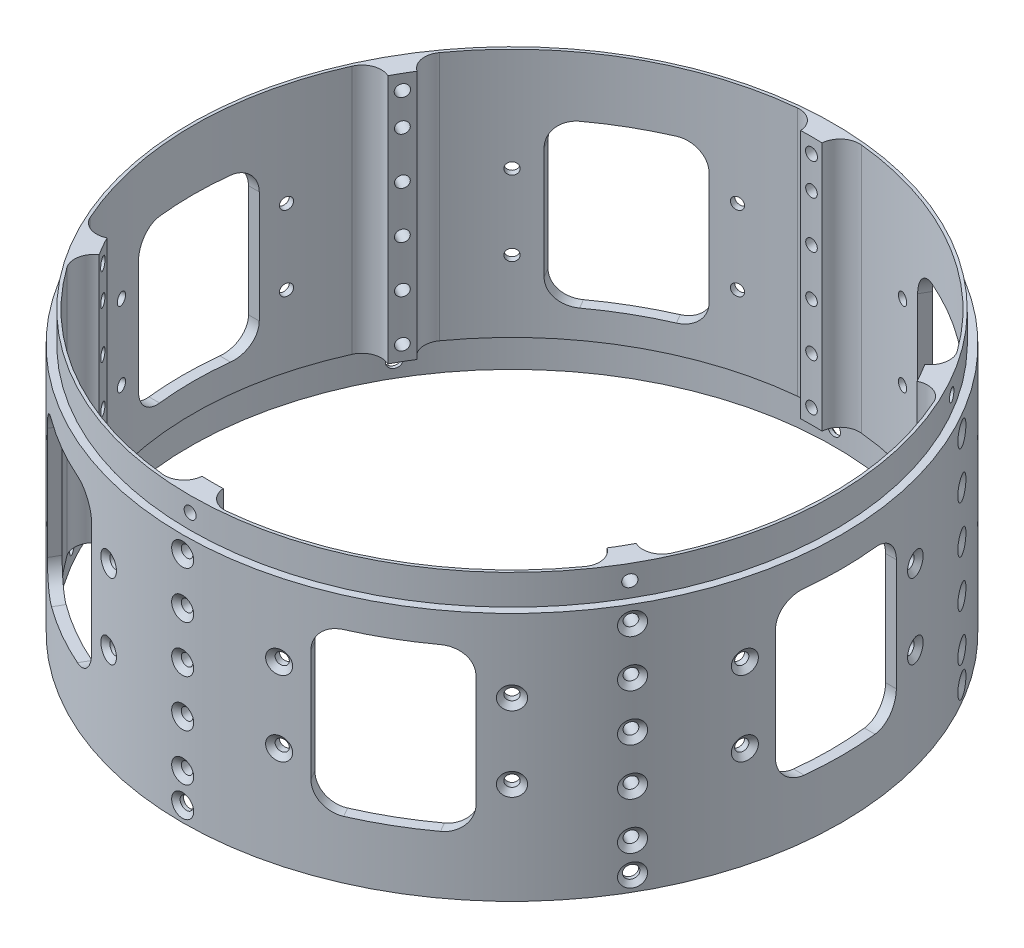
from build123d import *

# Parameters (mm, degrees)
CUT_EXTRUDE1_DEPTH                          = 139.23761861374788
CIRPATTERN1_COUNT                           = 6
CSK_FOR_4_FLAT_HEAD_MACHINE_SCREW_2_A_COUNT = 2
CSK_FOR_4_FLAT_HEAD_MACHINE_SCREW_2_A_PITCH = 11.938000000000002
CSK_FOR_4_FLAT_HEAD_MACHINE_SCREW_3_COUNT   = 2
CSK_FOR_4_FLAT_HEAD_MACHINE_SCREW_3_PITCH   = 23.875999999999998
CSK_FOR_4_FLAT_HEAD_MACHINE_SCREW_4_COUNT   = 2
CSK_FOR_4_FLAT_HEAD_MACHINE_SCREW_4_PITCH   = 23.876000000000005
CSK_FOR_4_FLAT_HEAD_MACHINE_SCREW_5_COUNT   = 2
CSK_FOR_4_FLAT_HEAD_MACHINE_SCREW_5_PITCH   = 11.938000000000006
CIRPATTERN2_COUNT                           = 6
CUT_EXTRUDE2_DEPTH                          = 139.23761878646496
CSK_FOR_4_FLAT_HEAD_MACHINE_SCREW_6_A_COUNT = 2
CSK_FOR_4_FLAT_HEAD_MACHINE_SCREW_6_A_PITCH = 19.05
CIRPATTERN5_COUNT                           = 6


with BuildPart() as part:
    # Sketch1 → Revolve1 (revolve)
    with BuildSketch(Plane.XY, mode=Mode.PRIVATE) as revolve1_sk:
        Polygon((76.20000000000003, -63.5), (76.20000000000003, 0), (81.88960000000003, 0), (81.88960000000003, -7.6708), (83.82000000000004, -7.670799999999989), (83.82000000000004, -71.12), (81.94040000000005, -71.12), (81.94040000000004, -63.5), align=None)
    revolve(revolve1_sk.sketch.rotate(Axis((0, 42.39510168777739, 0), (0, -1, 0)), 90), axis=Axis((0, 42.39510168777739, 0), (0, -1, 0)))

    # Sketch2 → Cut-Extrude1 (cut, through all)
    with BuildSketch(Plane(origin=(0, 0, 0), x_dir=(1, 0, 0), z_dir=(0, 1, 0))):
        with BuildLine():
            ThreePointArc((-8.128016987239903, 80.71940796125271), (-40.563800000000136, 70.25856254806241), (-65.8410493792649, 47.39877317396734))
            ThreePointArc((-65.8410493792649, 47.39877317396734), (-64.72088607812911, 40.52071256804154), (-57.842825472203295, 41.64087586917733))
            ThreePointArc((-57.842825472203295, 41.64087586917733), (-35.63620000000011, 61.72370898868599), (-7.140643602440563, 70.9137942201863))
            ThreePointArc((-7.140643602440563, 70.9137942201863), (-2.7315234243070465, 76.3102877831192), (-8.128016987239903, 80.71940796125271))
        make_face()
    cut_extrude1 = extrude(amount=-CUT_EXTRUDE1_DEPTH, mode=Mode.SUBTRACT)

    # CirPattern1: Cut-Extrude1 ×6 about axis
    cirpattern1_axis = Axis((-4.682e-14, 0, 2.819e-14), (0, 1, 0))
    for i in range(1, CIRPATTERN1_COUNT):
        add(cut_extrude1.rotate(cirpattern1_axis, i * 360 / CIRPATTERN1_COUNT), mode=Mode.SUBTRACT)

    # Sketch4 → Tapped Hole for #4-40 Helicoil1 (revolve, cut)
    with BuildSketch(Plane(origin=(0, -3.8099999999999996, 83.82), x_dir=(0, -1, 0), z_dir=(1, 0, 0))):
        Polygon((0, 0), (-6.45e-15, 26.315711583398002), (1.5239999999999854, 25.400000000000006), (1.523999999999989, -1.37e-15), align=None)
    tapped_hole_for_4_40_helicoil1 = revolve(axis=Axis((0, -3.8099999999999996, 90.16999999999999), (0, 0, -1)), mode=Mode.SUBTRACT)

    # Sketch6 → CSK for _4 Flat Head Machine Screw _100 (revolve, cut)
    with BuildSketch(Plane(origin=(1.24e-15, -67.30999999999997, 83.82), x_dir=(0, -1, 0), z_dir=(1, 0, 0))):
        Polygon((0, 0), (-6.45e-15, 26.380574487222027), (1.6319499999999938, 25.4), (1.631949999999997, 1.0283585529893176), (2.8575, 0), align=None)
    csk_for_4_flat_head_machine_screw_100 = revolve(axis=Axis((1.24e-15, -67.30999999999997, 90.16999999999999), (0, 0, -1)), mode=Mode.SUBTRACT)

    # Sketch13 → CSK for _4 Flat Head Machine Screw _ 2 (revolve, cut)
    with BuildSketch(Plane(origin=(4.39e-15, -35.814, 83.82), x_dir=(0, -1, 0), z_dir=(1, 0, 0))):
        Polygon((0, 0), (-6.42e-15, 26.2851878639514), (1.473199999999994, 25.4), (1.473199999999997, 1.1615656194387118), (2.8575, 0), align=None)
    csk_for_4_flat_head_machine_screw_2 = revolve(axis=Axis((4.39e-15, -35.814, 90.16999999999999), (0, 0, -1)), mode=Mode.SUBTRACT)

    # CSK for _4 Flat Head Machine Screw _ 2 a: CSK for _4 Flat Head Machine Screw _ 2 ×2
    with Locations(*[(0, -i * CSK_FOR_4_FLAT_HEAD_MACHINE_SCREW_2_A_PITCH, 0) for i in range(1, CSK_FOR_4_FLAT_HEAD_MACHINE_SCREW_2_A_COUNT)]):
        add(csk_for_4_flat_head_machine_screw_2, mode=Mode.SUBTRACT)

    # CSK for _4 Flat Head Machine Screw _ 3: CSK for _4 Flat Head Machine Screw _ 2 ×2
    with Locations(*[(0, -i * CSK_FOR_4_FLAT_HEAD_MACHINE_SCREW_3_PITCH, 0) for i in range(1, CSK_FOR_4_FLAT_HEAD_MACHINE_SCREW_3_COUNT)]):
        add(csk_for_4_flat_head_machine_screw_2, mode=Mode.SUBTRACT)

    # CSK for _4 Flat Head Machine Screw _ 4: CSK for _4 Flat Head Machine Screw _ 2 ×2
    with Locations(*[(0, i * CSK_FOR_4_FLAT_HEAD_MACHINE_SCREW_4_PITCH, 0) for i in range(1, CSK_FOR_4_FLAT_HEAD_MACHINE_SCREW_4_COUNT)]):
        add(csk_for_4_flat_head_machine_screw_2, mode=Mode.SUBTRACT)

    # CSK for _4 Flat Head Machine Screw _ 5: CSK for _4 Flat Head Machine Screw _ 2 ×2
    with Locations(*[(0, i * CSK_FOR_4_FLAT_HEAD_MACHINE_SCREW_5_PITCH, 0) for i in range(1, CSK_FOR_4_FLAT_HEAD_MACHINE_SCREW_5_COUNT)]):
        add(csk_for_4_flat_head_machine_screw_2, mode=Mode.SUBTRACT)

    # CirPattern2: Tapped Hole for #4-40 Helicoil1, CSK for _4 Flat Head Machine Screw _100, CSK for _4 Flat Head Machine Screw _ 2 ×6 about axis
    cirpattern2_axis = Axis((0, 42.39510168777739, 0), (0, 1, 0))
    add([tapped_hole_for_4_40_helicoil1.rotate(cirpattern2_axis, i * 360 / CIRPATTERN2_COUNT) for i in range(1, CIRPATTERN2_COUNT)], mode=Mode.SUBTRACT)
    add([csk_for_4_flat_head_machine_screw_100.rotate(cirpattern2_axis, i * 360 / CIRPATTERN2_COUNT) for i in range(1, CIRPATTERN2_COUNT)], mode=Mode.SUBTRACT)
    add([csk_for_4_flat_head_machine_screw_2.rotate(cirpattern2_axis, i * 360 / CIRPATTERN2_COUNT) for i in range(1, CIRPATTERN2_COUNT)], mode=Mode.SUBTRACT)

    # CirPattern2 copy 1 sketch → CirPattern2 copy 1 (revolve, cut)
    with BuildSketch(Plane(origin=(72.59024934521163, -47.752, 41.910000000000004), x_dir=(0, -1, 0), z_dir=(0.5000000000000001, 0, -0.8660254037844386))):
        Polygon((0, 0), (-6.42e-15, 26.2851878639514), (1.473199999999994, 25.4), (1.473199999999997, 1.1615656194387118), (2.8575, 0), align=None)
    revolve(axis=Axis((78.08951065924282, -47.752, 45.085), (-0.8660254037844386, 0, -0.5000000000000001)), mode=Mode.SUBTRACT)

    # CirPattern2 copy 2 sketch → CirPattern2 copy 2 (revolve, cut)
    with BuildSketch(Plane(origin=(72.59024934521165, -47.752, -41.909999999999975), x_dir=(0, -1, 0), z_dir=(-0.4999999999999998, 0, -0.8660254037844387))):
        Polygon((0, 0), (-6.42e-15, 26.2851878639514), (1.473199999999994, 25.4), (1.473199999999997, 1.1615656194387118), (2.8575, 0), align=None)
    revolve(axis=Axis((78.08951065924283, -47.752, -45.08499999999997), (-0.8660254037844387, 0, 0.4999999999999998)), mode=Mode.SUBTRACT)

    # CirPattern2 copy 3 sketch → CirPattern2 copy 3 (revolve, cut)
    with BuildSketch(Plane(origin=(1.026e-14, -47.752, -83.82), x_dir=(0, -1, 0), z_dir=(-1, 0, -1.2e-16))):
        Polygon((0, 0), (-6.42e-15, 26.2851878639514), (1.473199999999994, 25.4), (1.473199999999997, 1.1615656194387118), (2.8575, 0), align=None)
    revolve(axis=Axis((1.104e-14, -47.752, -90.16999999999999), (-1.2e-16, 0, 1)), mode=Mode.SUBTRACT)

    # CirPattern2 copy 4 sketch → CirPattern2 copy 4 (revolve, cut)
    with BuildSketch(Plane(origin=(-72.59024934521162, -47.752, -41.91000000000003), x_dir=(0, -1, 0), z_dir=(-0.5000000000000004, 0, 0.8660254037844384))):
        Polygon((0, 0), (-6.42e-15, 26.2851878639514), (1.473199999999994, 25.4), (1.473199999999997, 1.1615656194387118), (2.8575, 0), align=None)
    revolve(axis=Axis((-78.08951065924279, -47.752, -45.085000000000036), (0.8660254037844384, 0, 0.5000000000000004)), mode=Mode.SUBTRACT)

    # CirPattern2 copy 5 sketch → CirPattern2 copy 5 (revolve, cut)
    with BuildSketch(Plane(origin=(-72.59024934521163, -47.752, 41.910000000000004), x_dir=(0, -1, 0), z_dir=(0.5000000000000001, 0, 0.8660254037844386))):
        Polygon((0, 0), (-6.42e-15, 26.2851878639514), (1.473199999999994, 25.4), (1.473199999999997, 1.1615656194387118), (2.8575, 0), align=None)
    revolve(axis=Axis((-78.08951065924282, -47.752, 45.085), (0.8660254037844386, 0, -0.5000000000000001)), mode=Mode.SUBTRACT)

    # CirPattern2 copy 6 sketch → CirPattern2 copy 6 (revolve, cut)
    with BuildSketch(Plane(origin=(72.59024934521163, -59.69, 41.910000000000004), x_dir=(0, -1, 0), z_dir=(0.5000000000000001, 0, -0.8660254037844386))):
        Polygon((0, 0), (-6.42e-15, 26.2851878639514), (1.473199999999994, 25.4), (1.473199999999997, 1.1615656194387118), (2.8575, 0), align=None)
    revolve(axis=Axis((78.08951065924282, -59.69, 45.085), (-0.8660254037844386, 0, -0.5000000000000001)), mode=Mode.SUBTRACT)

    # CirPattern2 copy 7 sketch → CirPattern2 copy 7 (revolve, cut)
    with BuildSketch(Plane(origin=(72.59024934521165, -59.69, -41.909999999999975), x_dir=(0, -1, 0), z_dir=(-0.4999999999999998, 0, -0.8660254037844387))):
        Polygon((0, 0), (-6.42e-15, 26.2851878639514), (1.473199999999994, 25.4), (1.473199999999997, 1.1615656194387118), (2.8575, 0), align=None)
    revolve(axis=Axis((78.08951065924283, -59.69, -45.08499999999997), (-0.8660254037844387, 0, 0.4999999999999998)), mode=Mode.SUBTRACT)

    # CirPattern2 copy 8 sketch → CirPattern2 copy 8 (revolve, cut)
    with BuildSketch(Plane(origin=(1.026e-14, -59.69, -83.82), x_dir=(0, -1, 0), z_dir=(-1, 0, -1.2e-16))):
        Polygon((0, 0), (-6.42e-15, 26.2851878639514), (1.473199999999994, 25.4), (1.473199999999997, 1.1615656194387118), (2.8575, 0), align=None)
    revolve(axis=Axis((1.104e-14, -59.69, -90.16999999999999), (-1.2e-16, 0, 1)), mode=Mode.SUBTRACT)

    # CirPattern2 copy 9 sketch → CirPattern2 copy 9 (revolve, cut)
    with BuildSketch(Plane(origin=(-72.59024934521162, -59.69, -41.91000000000003), x_dir=(0, -1, 0), z_dir=(-0.5000000000000004, 0, 0.8660254037844384))):
        Polygon((0, 0), (-6.42e-15, 26.2851878639514), (1.473199999999994, 25.4), (1.473199999999997, 1.1615656194387118), (2.8575, 0), align=None)
    revolve(axis=Axis((-78.08951065924279, -59.69, -45.085000000000036), (0.8660254037844384, 0, 0.5000000000000004)), mode=Mode.SUBTRACT)

    # CirPattern2 copy 10 sketch → CirPattern2 copy 10 (revolve, cut)
    with BuildSketch(Plane(origin=(-72.59024934521163, -59.69, 41.910000000000004), x_dir=(0, -1, 0), z_dir=(0.5000000000000001, 0, 0.8660254037844386))):
        Polygon((0, 0), (-6.42e-15, 26.2851878639514), (1.473199999999994, 25.4), (1.473199999999997, 1.1615656194387118), (2.8575, 0), align=None)
    revolve(axis=Axis((-78.08951065924282, -59.69, 45.085), (0.8660254037844386, 0, -0.5000000000000001)), mode=Mode.SUBTRACT)

    # CirPattern2 copy 11 sketch → CirPattern2 copy 11 (revolve, cut)
    with BuildSketch(Plane(origin=(72.59024934521163, -11.937999999999995, 41.910000000000004), x_dir=(0, -1, 0), z_dir=(0.5000000000000001, 0, -0.8660254037844386))):
        Polygon((0, 0), (-6.42e-15, 26.2851878639514), (1.473199999999994, 25.4), (1.473199999999997, 1.1615656194387118), (2.8575, 0), align=None)
    revolve(axis=Axis((78.08951065924282, -11.937999999999995, 45.085), (-0.8660254037844386, 0, -0.5000000000000001)), mode=Mode.SUBTRACT)

    # CirPattern2 copy 12 sketch → CirPattern2 copy 12 (revolve, cut)
    with BuildSketch(Plane(origin=(72.59024934521165, -11.937999999999995, -41.909999999999975), x_dir=(0, -1, 0), z_dir=(-0.4999999999999998, 0, -0.8660254037844387))):
        Polygon((0, 0), (-6.42e-15, 26.2851878639514), (1.473199999999994, 25.4), (1.473199999999997, 1.1615656194387118), (2.8575, 0), align=None)
    revolve(axis=Axis((78.08951065924283, -11.937999999999995, -45.08499999999997), (-0.8660254037844387, 0, 0.4999999999999998)), mode=Mode.SUBTRACT)

    # CirPattern2 copy 13 sketch → CirPattern2 copy 13 (revolve, cut)
    with BuildSketch(Plane(origin=(1.026e-14, -11.937999999999995, -83.82), x_dir=(0, -1, 0), z_dir=(-1, 0, -1.2e-16))):
        Polygon((0, 0), (-6.42e-15, 26.2851878639514), (1.473199999999994, 25.4), (1.473199999999997, 1.1615656194387118), (2.8575, 0), align=None)
    revolve(axis=Axis((1.104e-14, -11.937999999999995, -90.16999999999999), (-1.2e-16, 0, 1)), mode=Mode.SUBTRACT)

    # CirPattern2 copy 14 sketch → CirPattern2 copy 14 (revolve, cut)
    with BuildSketch(Plane(origin=(-72.59024934521162, -11.937999999999995, -41.91000000000003), x_dir=(0, -1, 0), z_dir=(-0.5000000000000004, 0, 0.8660254037844384))):
        Polygon((0, 0), (-6.42e-15, 26.2851878639514), (1.473199999999994, 25.4), (1.473199999999997, 1.1615656194387118), (2.8575, 0), align=None)
    revolve(axis=Axis((-78.08951065924279, -11.937999999999995, -45.085000000000036), (0.8660254037844384, 0, 0.5000000000000004)), mode=Mode.SUBTRACT)

    # CirPattern2 copy 15 sketch → CirPattern2 copy 15 (revolve, cut)
    with BuildSketch(Plane(origin=(-72.59024934521163, -11.937999999999995, 41.910000000000004), x_dir=(0, -1, 0), z_dir=(0.5000000000000001, 0, 0.8660254037844386))):
        Polygon((0, 0), (-6.42e-15, 26.2851878639514), (1.473199999999994, 25.4), (1.473199999999997, 1.1615656194387118), (2.8575, 0), align=None)
    revolve(axis=Axis((-78.08951065924282, -11.937999999999995, 45.085), (0.8660254037844386, 0, -0.5000000000000001)), mode=Mode.SUBTRACT)

    # CirPattern2 copy 16 sketch → CirPattern2 copy 16 (revolve, cut)
    with BuildSketch(Plane(origin=(72.59024934521163, -23.875999999999994, 41.910000000000004), x_dir=(0, -1, 0), z_dir=(0.5000000000000001, 0, -0.8660254037844386))):
        Polygon((0, 0), (-6.42e-15, 26.2851878639514), (1.473199999999994, 25.4), (1.473199999999997, 1.1615656194387118), (2.8575, 0), align=None)
    revolve(axis=Axis((78.08951065924282, -23.875999999999994, 45.085), (-0.8660254037844386, 0, -0.5000000000000001)), mode=Mode.SUBTRACT)

    # CirPattern2 copy 17 sketch → CirPattern2 copy 17 (revolve, cut)
    with BuildSketch(Plane(origin=(72.59024934521165, -23.875999999999994, -41.909999999999975), x_dir=(0, -1, 0), z_dir=(-0.4999999999999998, 0, -0.8660254037844387))):
        Polygon((0, 0), (-6.42e-15, 26.2851878639514), (1.473199999999994, 25.4), (1.473199999999997, 1.1615656194387118), (2.8575, 0), align=None)
    revolve(axis=Axis((78.08951065924283, -23.875999999999994, -45.08499999999997), (-0.8660254037844387, 0, 0.4999999999999998)), mode=Mode.SUBTRACT)

    # CirPattern2 copy 18 sketch → CirPattern2 copy 18 (revolve, cut)
    with BuildSketch(Plane(origin=(1.026e-14, -23.875999999999994, -83.82), x_dir=(0, -1, 0), z_dir=(-1, 0, -1.2e-16))):
        Polygon((0, 0), (-6.42e-15, 26.2851878639514), (1.473199999999994, 25.4), (1.473199999999997, 1.1615656194387118), (2.8575, 0), align=None)
    revolve(axis=Axis((1.104e-14, -23.875999999999994, -90.16999999999999), (-1.2e-16, 0, 1)), mode=Mode.SUBTRACT)

    # CirPattern2 copy 19 sketch → CirPattern2 copy 19 (revolve, cut)
    with BuildSketch(Plane(origin=(-72.59024934521162, -23.875999999999994, -41.91000000000003), x_dir=(0, -1, 0), z_dir=(-0.5000000000000004, 0, 0.8660254037844384))):
        Polygon((0, 0), (-6.42e-15, 26.2851878639514), (1.473199999999994, 25.4), (1.473199999999997, 1.1615656194387118), (2.8575, 0), align=None)
    revolve(axis=Axis((-78.08951065924279, -23.875999999999994, -45.085000000000036), (0.8660254037844384, 0, 0.5000000000000004)), mode=Mode.SUBTRACT)

    # CirPattern2 copy 20 sketch → CirPattern2 copy 20 (revolve, cut)
    with BuildSketch(Plane(origin=(-72.59024934521163, -23.875999999999994, 41.910000000000004), x_dir=(0, -1, 0), z_dir=(0.5000000000000001, 0, 0.8660254037844386))):
        Polygon((0, 0), (-6.42e-15, 26.2851878639514), (1.473199999999994, 25.4), (1.473199999999997, 1.1615656194387118), (2.8575, 0), align=None)
    revolve(axis=Axis((-78.08951065924282, -23.875999999999994, 45.085), (0.8660254037844386, 0, -0.5000000000000001)), mode=Mode.SUBTRACT)

    # Sketch7 → Cut-Extrude2 (cut, through all)
    with BuildSketch(Plane(origin=(0, 0, 0), x_dir=(0, 0, -1), z_dir=(1, 0, 0))):
        with BuildLine():
            Line((-9.017000000000001, -15.24), (9.016999999999998, -15.239999999999998))
            ThreePointArc((9.016999999999998, -15.239999999999998), (13.507128060534573, -17.099871939465423), (15.366999999999996, -21.589999999999996))
            Line((15.366999999999996, -21.589999999999996), (15.367, -50.038))
            ThreePointArc((15.367, -50.038), (13.50712806053458, -54.52812806053458), (9.017000000000001, -56.388))
            Line((9.017000000000001, -56.388), (-9.016999999999998, -56.388))
            ThreePointArc((-9.016999999999998, -56.388), (-13.507128060534576, -54.52812806053458), (-15.366999999999999, -50.038))
            Line((-15.366999999999999, -50.038), (-15.367000000000003, -21.589999999999996))
            ThreePointArc((-15.367000000000003, -21.589999999999996), (-13.507128060534574, -17.099871939465423), (-9.017000000000001, -15.24))
        make_face()
    cut_extrude2 = extrude(amount=-CUT_EXTRUDE2_DEPTH, mode=Mode.SUBTRACT)

    # Sketch11 → CSK for _4 Flat Head Machine Screw _ 6 (revolve, cut)
    with BuildSketch(Plane(origin=(-80.96390275954971, -26.288999999999998, 21.694212360493403), x_dir=(0.25881904510252207, 0, 0.9659258262890681), z_dir=(0, 1, 0))):
        Polygon((0, 0), (-6.44e-15, 26.2851878639514), (1.4731999999999852, 25.39999999999999), (1.4731999999999967, 1.1615656194387154), (2.857499999999999, -1.73e-15), align=None)
    csk_for_4_flat_head_machine_screw_6 = revolve(axis=Axis((-87.09753175648528, -26.288999999999998, 23.337713296894414), (0.965925826289068, 0, -0.258819045102522)), mode=Mode.SUBTRACT)

    # CSK for _4 Flat Head Machine Screw _ 6 a: CSK for _4 Flat Head Machine Screw _ 6 ×2
    with Locations(*[(0, -i * CSK_FOR_4_FLAT_HEAD_MACHINE_SCREW_6_A_PITCH, 0) for i in range(1, CSK_FOR_4_FLAT_HEAD_MACHINE_SCREW_6_A_COUNT)]):
        add(csk_for_4_flat_head_machine_screw_6, mode=Mode.SUBTRACT)

    # Mirror1: CSK for _4 Flat Head Machine Screw _ 6 across plane
    add(csk_for_4_flat_head_machine_screw_6.mirror(Plane.XY), mode=Mode.SUBTRACT)

    # Mirror1 copy 1 sketch → Mirror1 copy 1 (revolve, cut)
    with BuildSketch(Plane(origin=(-80.96390275954971, -45.339, -21.694212360493406), x_dir=(0.25881904510252207, 0, -0.9659258262890681), z_dir=(0, 1, 0))):
        Polygon((0, 0), (-6.44e-15, -26.2851878639514), (1.4731999999999852, -25.39999999999999), (1.4731999999999967, -1.1615656194387154), (2.857499999999999, 1.73e-15), align=None)
    revolve(axis=Axis((-87.09753175648528, -45.339, -23.337713296894417), (-0.965925826289068, 0, -0.258819045102522)), mode=Mode.SUBTRACT)

    # CirPattern5: Cut-Extrude2, CSK for _4 Flat Head Machine Screw _ 6 ×6 about axis
    cirpattern5_axis = Axis((3e-17, 0, 3.9e-16), (0, 1, 0))
    add([cut_extrude2.rotate(cirpattern5_axis, i * 360 / CIRPATTERN5_COUNT) for i in range(1, CIRPATTERN5_COUNT)], mode=Mode.SUBTRACT)
    add([csk_for_4_flat_head_machine_screw_6.rotate(cirpattern5_axis, i * 360 / CIRPATTERN5_COUNT) for i in range(1, CIRPATTERN5_COUNT)], mode=Mode.SUBTRACT)

    # CirPattern5 copy 1 sketch → CirPattern5 copy 1 (revolve, cut)
    with BuildSketch(Plane(origin=(-21.6942123604932, -45.339, 80.96390275954975), x_dir=(0.9659258262890688, 0, 0.25881904510251963), z_dir=(0, 1, 0))):
        Polygon((0, 0), (-6.44e-15, 26.2851878639514), (1.4731999999999852, 25.39999999999999), (1.4731999999999967, 1.1615656194387154), (2.857499999999999, -1.73e-15), align=None)
    revolve(axis=Axis((-23.337713296894197, -45.339, 87.09753175648534), (0.25881904510251963, 0, -0.9659258262890686)), mode=Mode.SUBTRACT)

    # CirPattern5 copy 2 sketch → CirPattern5 copy 2 (revolve, cut)
    with BuildSketch(Plane(origin=(59.26969039905649, -45.339, 59.26969039905637), x_dir=(0.7071067811865468, 0, -0.7071067811865483), z_dir=(0, 1, 0))):
        Polygon((0, 0), (-6.44e-15, 26.2851878639514), (1.4731999999999852, 25.39999999999999), (1.4731999999999967, 1.1615656194387154), (2.857499999999999, -1.73e-15), align=None)
    revolve(axis=Axis((63.759818459591074, -45.339, 63.75981845959093), (-0.7071067811865482, 0, -0.7071067811865468)), mode=Mode.SUBTRACT)

    # CirPattern5 copy 3 sketch → CirPattern5 copy 3 (revolve, cut)
    with BuildSketch(Plane(origin=(80.96390275954971, -45.339, -21.694212360493395), x_dir=(-0.25881904510252196, 0, -0.9659258262890681), z_dir=(0, 1, 0))):
        Polygon((0, 0), (-6.44e-15, 26.2851878639514), (1.4731999999999852, 25.39999999999999), (1.4731999999999967, 1.1615656194387154), (2.857499999999999, -1.73e-15), align=None)
    revolve(axis=Axis((87.09753175648528, -45.339, -23.337713296894407), (-0.965925826289068, 0, 0.2588190451025219)), mode=Mode.SUBTRACT)

    # CirPattern5 copy 4 sketch → CirPattern5 copy 4 (revolve, cut)
    with BuildSketch(Plane(origin=(21.694212360493236, -45.339, -80.96390275954975), x_dir=(-0.9659258262890686, 0, -0.2588190451025201), z_dir=(0, 1, 0))):
        Polygon((0, 0), (-6.44e-15, 26.2851878639514), (1.4731999999999852, 25.39999999999999), (1.4731999999999967, 1.1615656194387154), (2.857499999999999, -1.73e-15), align=None)
    revolve(axis=Axis((23.337713296894233, -45.339, -87.09753175648532), (-0.2588190451025201, 0, 0.9659258262890685)), mode=Mode.SUBTRACT)

    # CirPattern5 copy 5 sketch → CirPattern5 copy 5 (revolve, cut)
    with BuildSketch(Plane(origin=(-59.26969039905652, -45.339, -59.26969039905635), x_dir=(-0.7071067811865467, 0, 0.7071067811865487), z_dir=(0, 1, 0))):
        Polygon((0, 0), (-6.44e-15, 26.2851878639514), (1.4731999999999852, 25.39999999999999), (1.4731999999999967, 1.1615656194387154), (2.857499999999999, -1.73e-15), align=None)
    revolve(axis=Axis((-63.759818459591095, -45.339, -63.759818459590925), (0.7071067811865486, 0, 0.7071067811865466)), mode=Mode.SUBTRACT)

    # CirPattern5 copy 6 sketch → CirPattern5 copy 6 (revolve, cut)
    with BuildSketch(Plane(origin=(-59.26969039905652, -26.288999999999998, 59.26969039905635), x_dir=(-0.7071067811865467, 0, -0.7071067811865487), z_dir=(0, 1, 0))):
        Polygon((0, 0), (-6.44e-15, -26.2851878639514), (1.4731999999999852, -25.39999999999999), (1.4731999999999967, -1.1615656194387154), (2.857499999999999, 1.73e-15), align=None)
    revolve(axis=Axis((-63.759818459591095, -26.288999999999998, 63.759818459590925), (-0.7071067811865486, 0, 0.7071067811865466)), mode=Mode.SUBTRACT)

    # CirPattern5 copy 7 sketch → CirPattern5 copy 7 (revolve, cut)
    with BuildSketch(Plane(origin=(21.694212360493175, -26.288999999999998, 80.96390275954977), x_dir=(-0.9659258262890689, 0, 0.2588190451025193), z_dir=(0, 1, 0))):
        Polygon((0, 0), (-6.44e-15, -26.2851878639514), (1.4731999999999852, -25.39999999999999), (1.4731999999999967, -1.1615656194387154), (2.857499999999999, 1.73e-15), align=None)
    revolve(axis=Axis((23.33771329689417, -26.288999999999998, 87.09753175648534), (0.2588190451025193, 0, 0.9659258262890686)), mode=Mode.SUBTRACT)

    # CirPattern5 copy 8 sketch → CirPattern5 copy 8 (revolve, cut)
    with BuildSketch(Plane(origin=(80.96390275954971, -26.288999999999998, 21.694212360493413), x_dir=(-0.2588190451025222, 0, 0.9659258262890681), z_dir=(0, 1, 0))):
        Polygon((0, 0), (-6.44e-15, -26.2851878639514), (1.4731999999999852, -25.39999999999999), (1.4731999999999967, -1.1615656194387154), (2.857499999999999, 1.73e-15), align=None)
    revolve(axis=Axis((87.09753175648528, -26.288999999999998, 23.337713296894425), (0.965925826289068, 0, 0.2588190451025221)), mode=Mode.SUBTRACT)

    # CirPattern5 copy 9 sketch → CirPattern5 copy 9 (revolve, cut)
    with BuildSketch(Plane(origin=(59.26969039905654, -26.288999999999998, -59.26969039905633), x_dir=(0.7071067811865464, 0, 0.7071067811865489), z_dir=(0, 1, 0))):
        Polygon((0, 0), (-6.44e-15, -26.2851878639514), (1.4731999999999852, -25.39999999999999), (1.4731999999999967, -1.1615656194387154), (2.857499999999999, 1.73e-15), align=None)
    revolve(axis=Axis((63.759818459591116, -26.288999999999998, -63.75981845959089), (0.7071067811865488, 0, -0.7071067811865462)), mode=Mode.SUBTRACT)

    # CirPattern5 copy 10 sketch → CirPattern5 copy 10 (revolve, cut)
    with BuildSketch(Plane(origin=(-21.694212360493204, -26.288999999999998, -80.96390275954975), x_dir=(0.9659258262890688, 0, -0.25881904510251963), z_dir=(0, 1, 0))):
        Polygon((0, 0), (-6.44e-15, -26.2851878639514), (1.4731999999999852, -25.39999999999999), (1.4731999999999967, -1.1615656194387154), (2.857499999999999, 1.73e-15), align=None)
    revolve(axis=Axis((-23.3377132968942, -26.288999999999998, -87.09753175648534), (-0.25881904510251963, 0, -0.9659258262890686)), mode=Mode.SUBTRACT)

    # CirPattern5 copy 11 sketch → CirPattern5 copy 11 (revolve, cut)
    with BuildSketch(Plane(origin=(-59.26969039905652, -45.339, 59.26969039905635), x_dir=(-0.7071067811865467, 0, -0.7071067811865487), z_dir=(0, 1, 0))):
        Polygon((0, 0), (-6.44e-15, -26.2851878639514), (1.4731999999999852, -25.39999999999999), (1.4731999999999967, -1.1615656194387154), (2.857499999999999, 1.73e-15), align=None)
    revolve(axis=Axis((-63.759818459591095, -45.339, 63.759818459590925), (-0.7071067811865486, 0, 0.7071067811865466)), mode=Mode.SUBTRACT)

    # CirPattern5 copy 12 sketch → CirPattern5 copy 12 (revolve, cut)
    with BuildSketch(Plane(origin=(21.69421236049317, -45.339, 80.96390275954977), x_dir=(-0.9659258262890689, 0, 0.2588190451025193), z_dir=(0, 1, 0))):
        Polygon((0, 0), (-6.44e-15, -26.2851878639514), (1.4731999999999852, -25.39999999999999), (1.4731999999999967, -1.1615656194387154), (2.857499999999999, 1.73e-15), align=None)
    revolve(axis=Axis((23.337713296894165, -45.339, 87.09753175648534), (0.2588190451025193, 0, 0.9659258262890686)), mode=Mode.SUBTRACT)

    # CirPattern5 copy 13 sketch → CirPattern5 copy 13 (revolve, cut)
    with BuildSketch(Plane(origin=(80.96390275954971, -45.339, 21.694212360493417), x_dir=(-0.2588190451025222, 0, 0.9659258262890681), z_dir=(0, 1, 0))):
        Polygon((0, 0), (-6.44e-15, -26.2851878639514), (1.4731999999999852, -25.39999999999999), (1.4731999999999967, -1.1615656194387154), (2.857499999999999, 1.73e-15), align=None)
    revolve(axis=Axis((87.09753175648528, -45.339, 23.337713296894428), (0.965925826289068, 0, 0.2588190451025221)), mode=Mode.SUBTRACT)

    # CirPattern5 copy 14 sketch → CirPattern5 copy 14 (revolve, cut)
    with BuildSketch(Plane(origin=(59.26969039905654, -45.339, -59.26969039905633), x_dir=(0.7071067811865464, 0, 0.7071067811865489), z_dir=(0, 1, 0))):
        Polygon((0, 0), (-6.44e-15, -26.2851878639514), (1.4731999999999852, -25.39999999999999), (1.4731999999999967, -1.1615656194387154), (2.857499999999999, 1.73e-15), align=None)
    revolve(axis=Axis((63.759818459591116, -45.339, -63.75981845959089), (0.7071067811865488, 0, -0.7071067811865462)), mode=Mode.SUBTRACT)

    # CirPattern5 copy 15 sketch → CirPattern5 copy 15 (revolve, cut)
    with BuildSketch(Plane(origin=(-21.6942123604932, -45.339, -80.96390275954975), x_dir=(0.9659258262890688, 0, -0.25881904510251963), z_dir=(0, 1, 0))):
        Polygon((0, 0), (-6.44e-15, -26.2851878639514), (1.4731999999999852, -25.39999999999999), (1.4731999999999967, -1.1615656194387154), (2.857499999999999, 1.73e-15), align=None)
    revolve(axis=Axis((-23.337713296894197, -45.339, -87.09753175648534), (-0.25881904510251963, 0, -0.9659258262890686)), mode=Mode.SUBTRACT)


solid = part.part
